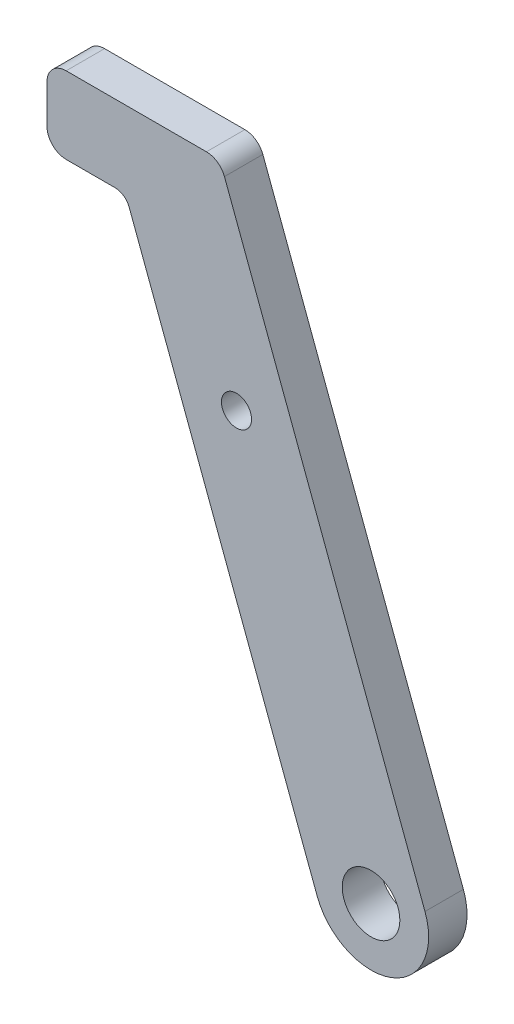
from build123d import *

# Parameters (mm, degrees)
SKETCH13_R          = 4.7625
SKETCH13_R_2        = 2.4892
BOSS_EXTRUDE1_DEPTH = 6.35
FILLET1_R           = 3.175


with BuildPart() as part:
    # Sketch13 → Boss-Extrude1 (new body)
    with BuildSketch(Plane.XY):
        with BuildLine():
            Line((77.095400293, 645.1727), (111.029305512, 554.453554534))
            ThreePointArc((111.029305512, 554.453554534), (105.445054534, 542.195194488), (93.186694488, 547.779445466))
            Line((93.186694488, 547.779445466), (93.106573521, 547.993641434))
            Line((93.106573521, 547.993641434), (62.111690613, 630.855583585))
            ThreePointArc((62.111690613, 630.855583585), (61.198939683, 632.028849249), (59.780256106, 632.4727))
            Line((59.780256106, 632.4727), (48.520400293, 632.4727))
            Line((48.520400293, 632.4727), (48.520400293, 645.1727))
            Line((48.520400293, 645.1727), (77.095400293, 645.1727))
        make_face()
        with Locations((102.108, 551.1165)):
            Circle(SKETCH13_R, mode=Mode.SUBTRACT)
        with Locations((79.860969775, 610.59187008)):
            Circle(SKETCH13_R_2, mode=Mode.SUBTRACT)
    extrude(amount=-BOSS_EXTRUDE1_DEPTH)

    # Fillet1
    fillet1_edges = [part.edges().sort_by_distance(p)[0] for p in [
        (48.520400293, 632.4727, -3.175),
        (77.095400293, 645.1727, -3.175),
        (48.520400293, 645.1727, -3.175),
    ]]
    fillet(fillet1_edges, radius=FILLET1_R)


solid = part.part
